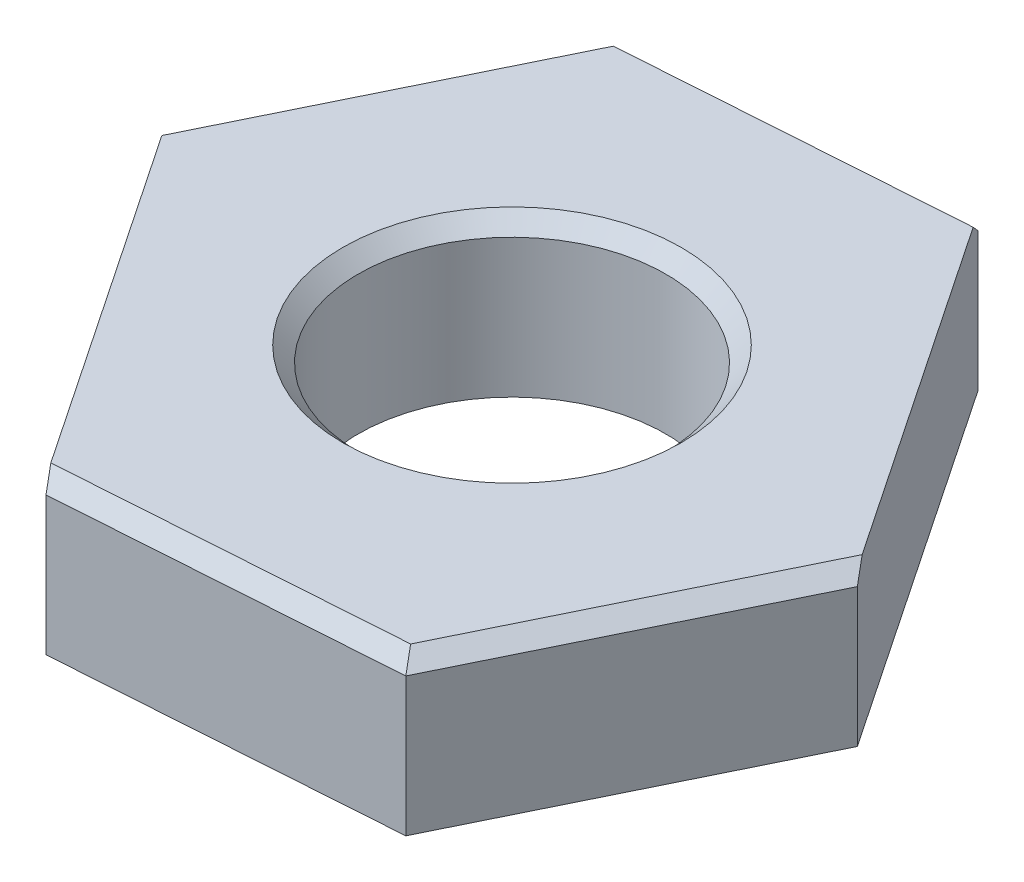
from build123d import *

# Parameters (mm, degrees)
SKETCH1_R           = 5
BOSS_EXTRUDE1_DEPTH = 5
CHAMFER1_SIZE       = 0.5
CUT_EXTRUDE1_DEPTH  = 18.76901793


with BuildPart() as part:
    # Sketch1 → Boss-Extrude1 (new body)
    with BuildSketch(Plane(origin=(0, 0, 0), x_dir=(1, 0, 0), z_dir=(0, 1, 0))):
        Polygon((7.08862867, -10.539671575), (12.671937667, 0.869096719), (5.583308997, 11.408768294), (-7.08862867, 10.539671575), (-12.671937667, -0.869096719), (-5.583308997, -11.408768294), align=None)
        Circle(SKETCH1_R, mode=Mode.SUBTRACT)
    extrude(amount=BOSS_EXTRUDE1_DEPTH)

    # Chamfer1
    chamfer1_edges = [part.edges().sort_by_distance(p)[0] for p in [
        (-5, 5, 0),
        (-9.127623332, 5, 6.138932506),
        (-9.880283168, 5, -4.835287428),
        (-0.752659837, 5, -10.974219934),
        (9.127623332, 5, -6.138932506),
        (9.880283168, 5, 4.835287428),
        (0.752659837, 5, 10.974219934),
    ]]
    chamfer(chamfer1_edges, length=CHAMFER1_SIZE)

    # Sketch2 → Cut-Extrude1 (cut, through all)
    with BuildSketch(Plane(origin=(0, 5, 0), x_dir=(1, 0, 0), z_dir=(0, 1, 0))):
        Polygon((-12.369841003, 1.369496951), (-3.313446114, -12.095932292), (-6.221668225, -14.051904686), (-15.278063114, -0.586475443), align=None)
        Polygon((3.396053842, 11.973107643), (6.304275954, 13.929080037), (15.360670843, 0.463650794), (12.452448732, -1.4923216), align=None)
    extrude(amount=-CUT_EXTRUDE1_DEPTH, mode=Mode.SUBTRACT)


solid = part.part
